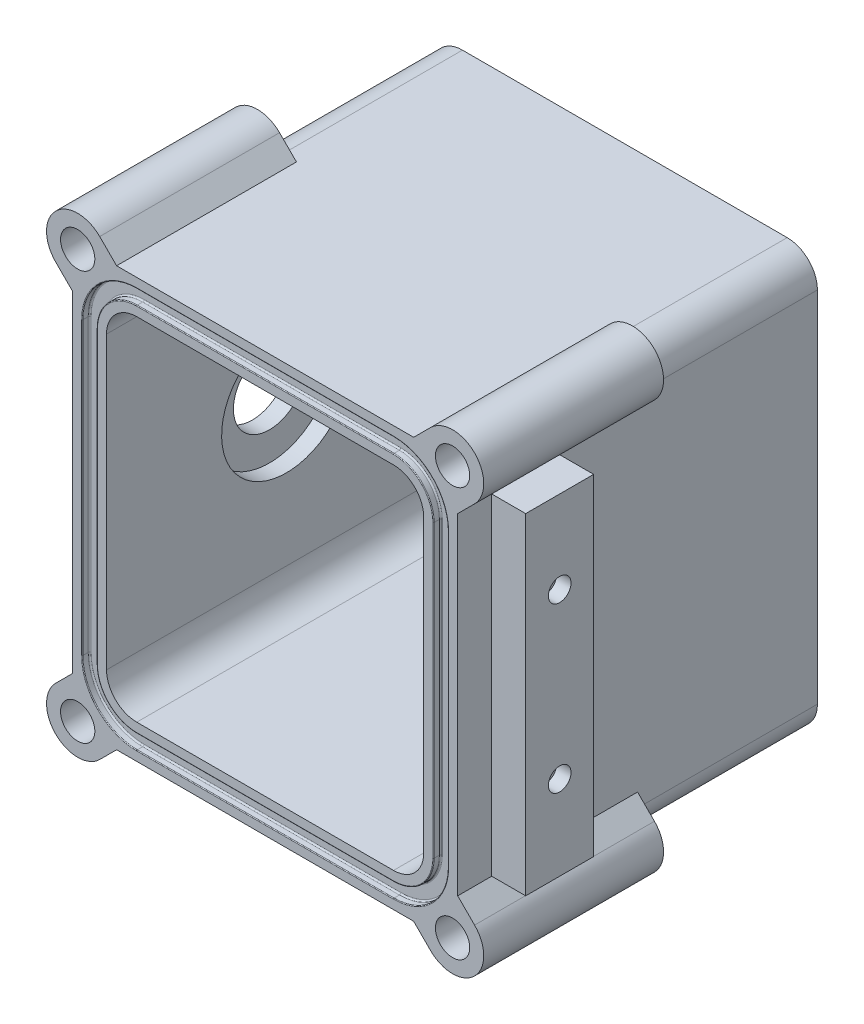
from build123d import *

# Parameters (mm, degrees)
BOSS_EXTRUDE1_DEPTH     = 31.75
SHELL1_T                = -6
FILLET1_R               = 5.334
CUT_EXTRUDE1_DEPTH      = 1.2954
FILLET2_R               = 0.254
FILLET3_R               = 0.127
BOSS_EXTRUDE2_DEPTH     = 31.75
SKETCH4_R               = 3.025
CUT_EXTRUDE2_DEPTH      = 9
MIRROR2_COPY_1_DEPTH    = 31.75
MIRROR2_COPY_2_SKETCH_R = 3.025
MIRROR2_COPY_2_DEPTH    = 9
SKETCH8_W               = 12
SKETCH8_H               = 58.443650814
BOSS_EXTRUDE3_DEPTH     = 6
SKETCH12_R              = 2
CUT_EXTRUDE6_DEPTH      = 2.54
SKETCH13_R              = 6.35
CUT_EXTRUDE10_DEPTH     = 6
SKETCH16_R              = 11.43
CUT_EXTRUDE14_DEPTH     = 3


with BuildPart() as part:
    # Sketch1 → Boss-Extrude1 (new, symmetric)
    with BuildSketch(Plane.XY):
        Polygon((-34, -37), (-34, -16.68), (-34, 16.68), (-34, 37), (34, 37), (34, -37), align=None)
    extrude(amount=BOSS_EXTRUDE1_DEPTH, both=True)

    # Shell1
    shell1_openings = [part.faces().sort_by_distance(p)[0] for p in [
        (0, 0, 31.75),
    ]]
    offset(amount=SHELL1_T, openings=shell1_openings, kind=Kind.INTERSECTION)

    # Fillet1
    fillet1_edges = [part.edges().sort_by_distance(p)[0] for p in [
        (34, 37, 0),
        (34, -37, 0),
        (-34, -37, 0),
        (-34, 37, 0),
        (28, 31, 3),
        (28, -31, 3),
        (-28, -31, 3),
        (-28, 31, 3),
    ]]
    fillet(fillet1_edges, radius=FILLET1_R)

    # Sketch2 → Cut-Extrude1 (cut)
    with BuildSketch(Plane.XY.offset(31.75)):
        with BuildLine():
            Line((32.2827, -25.666), (32.2827, 25.666))
            ThreePointArc((32.2827, 25.666), (29.466033783, 32.466033783), (22.666, 35.2827))
            Line((22.666, 35.2827), (-22.666, 35.2827))
            ThreePointArc((-22.666, 35.2827), (-29.466033783, 32.466033783), (-32.2827, 25.666))
            Line((-32.2827, 25.666), (-32.2827, -25.666))
            ThreePointArc((-32.2827, -25.666), (-29.466033783, -32.466033783), (-22.666, -35.2827))
            Line((-22.666, -35.2827), (22.666, -35.2827))
            ThreePointArc((22.666, -35.2827), (29.466033783, -32.466033783), (32.2827, -25.666))
        make_face()
        with BuildLine():
            Line((-29.7173, 25.666), (-29.7173, -25.666))
            ThreePointArc((-29.7173, -25.666), (-27.652022046, -30.652022046), (-22.666, -32.7173))
            Line((-22.666, -32.7173), (22.666, -32.7173))
            ThreePointArc((22.666, -32.7173), (27.652022046, -30.652022046), (29.7173, -25.666))
            Line((29.7173, -25.666), (29.7173, 25.666))
            ThreePointArc((29.7173, 25.666), (27.652022046, 30.652022046), (22.666, 32.7173))
            Line((22.666, 32.7173), (-22.666, 32.7173))
            ThreePointArc((-22.666, 32.7173), (-27.652022046, 30.652022046), (-29.7173, 25.666))
        make_face(mode=Mode.SUBTRACT)
    extrude(amount=-CUT_EXTRUDE1_DEPTH, mode=Mode.SUBTRACT)

    # Fillet2
    fillet2_edges = [part.edges().sort_by_distance(p)[0] for p in [
        (27.652022046, -30.652022046, 30.4546),
        (0, -32.7173, 30.4546),
        (-27.652022046, -30.652022046, 30.4546),
        (-29.7173, 0, 30.4546),
        (-27.652022046, 30.652022046, 30.4546),
        (0, 32.7173, 30.4546),
        (27.652022046, 30.652022046, 30.4546),
        (-29.466033783, 32.466033783, 30.4546),
        (0, 35.2827, 30.4546),
        (29.466033783, 32.466033783, 30.4546),
        (32.2827, 0, 30.4546),
        (29.466033783, -32.466033783, 30.4546),
        (0, -35.2827, 30.4546),
        (-29.466033783, -32.466033783, 30.4546),
        (29.7173, 0, 30.4546),
        (-32.2827, 0, 30.4546),
    ]]
    fillet(fillet2_edges, radius=FILLET2_R)

    # Fillet3
    fillet3_edges = [part.edges().sort_by_distance(p)[0] for p in [
        (-29.466033783, -32.466033783, 31.75),
        (-32.2827, 0, 31.75),
        (-29.466033783, 32.466033783, 31.75),
        (0, 35.2827, 31.75),
        (29.466033783, 32.466033783, 31.75),
        (32.2827, 0, 31.75),
        (29.466033783, -32.466033783, 31.75),
        (-27.652022046, -30.652022046, 31.75),
        (-29.7173, 0, 31.75),
        (-27.652022046, 30.652022046, 31.75),
        (0, 32.7173, 31.75),
        (27.652022046, 30.652022046, 31.75),
        (29.7173, 0, 31.75),
        (27.652022046, -30.652022046, 31.75),
        (0, -35.2827, 31.75),
        (0, -32.7173, 31.75),
    ]]
    fillet(fillet3_edges, radius=FILLET3_R)

    # Sketch3 → Boss-Extrude2 (add)
    with BuildSketch(Plane.XY.offset(31.75)):
        with BuildLine():
            ThreePointArc((30.741024965, -31.118858104), (29.555836344, -32.555836344), (28.118858104, -33.741024965))
            ThreePointArc((28.118858104, -33.741024965), (27.643498403, -35.335928432), (27.666944752, -37))
            Line((27.666944752, -37), (26.221825407, -37))
            Line((26.221825407, -37), (29.202282953, -39.980457546))
            ThreePointArc((29.202282953, -39.980457546), (36.980457546, -39.980457546), (36.980457546, -32.202282953))
            Line((36.980457546, -32.202282953), (34, -29.221825407))
            Line((34, -29.221825407), (34, -30.666944752))
            ThreePointArc((34, -30.666944752), (32.335928432, -30.643498403), (30.741024965, -31.118858104))
        make_face()
    boss_extrude2 = extrude(amount=-BOSS_EXTRUDE2_DEPTH)

    # Sketch4 → Cut-Extrude2 (cut)
    with BuildSketch(Plane.XY.offset(31.75)):
        with Locations((33.09137025, -36.09137025)):
            Circle(SKETCH4_R)
    cut_extrude2 = extrude(amount=-CUT_EXTRUDE2_DEPTH, mode=Mode.SUBTRACT)

    # Mirror1: Boss-Extrude2, Cut-Extrude2 across plane
    add(boss_extrude2.mirror(Plane.ZX))
    add(cut_extrude2.mirror(Plane.ZX), mode=Mode.SUBTRACT)

    # Mirror2: Boss-Extrude2, Cut-Extrude2 across plane
    add(boss_extrude2.mirror(Plane(origin=(0, 0, 0), x_dir=(0, 0, 1), z_dir=(1, 0, 0))))
    add(cut_extrude2.mirror(Plane(origin=(0, 0, 0), x_dir=(0, 0, 1), z_dir=(1, 0, 0))), mode=Mode.SUBTRACT)

    # Mirror2 copy 1 sketch → Mirror2 copy 1 (add)
    with BuildSketch(Plane(origin=(0, 0, 31.75), x_dir=(-1, 0, 0), z_dir=(0, 0, 1))):
        with BuildLine():
            ThreePointArc((30.741024965, -31.118858104), (29.555836344, -32.555836344), (28.118858104, -33.741024965))
            ThreePointArc((28.118858104, -33.741024965), (27.643498403, -35.335928432), (27.666944752, -37))
            Line((27.666944752, -37), (26.221825407, -37))
            Line((26.221825407, -37), (29.202282953, -39.980457546))
            ThreePointArc((29.202282953, -39.980457546), (36.980457546, -39.980457546), (36.980457546, -32.202282953))
            Line((36.980457546, -32.202282953), (34, -29.221825407))
            Line((34, -29.221825407), (34, -30.666944752))
            ThreePointArc((34, -30.666944752), (32.335928432, -30.643498403), (30.741024965, -31.118858104))
        make_face()
    extrude(amount=-MIRROR2_COPY_1_DEPTH)

    # Mirror2 copy 2 sketch → Mirror2 copy 2 (cut)
    with BuildSketch(Plane(origin=(0, 0, 31.75), x_dir=(-1, 0, 0), z_dir=(0, 0, 1))):
        with Locations((33.09137025, -36.09137025)):
            Circle(MIRROR2_COPY_2_SKETCH_R)
    extrude(amount=-MIRROR2_COPY_2_DEPTH, mode=Mode.SUBTRACT)

    # Sketch8 → Boss-Extrude3 (add)
    with BuildSketch(Plane.ZY.offset(34)):
        with Locations((19.75, 0)):
            Rectangle(SKETCH8_W, SKETCH8_H)
    boss_extrude3 = extrude(amount=BOSS_EXTRUDE3_DEPTH)

    # Sketch12 → Cut-Extrude6 (cut)
    with BuildSketch(Plane.ZY.offset(40)):
        with Locations((19.75, 14.616825407)):
            Circle(SKETCH12_R)
        with Locations((19.75, -14.339174593)):
            Circle(SKETCH12_R)
    cut_extrude6 = extrude(amount=-CUT_EXTRUDE6_DEPTH, mode=Mode.SUBTRACT)

    # Sketch13 → Cut-Extrude10 (cut)
    with BuildSketch(Plane.ZY.offset(34)):
        Circle(SKETCH13_R)
    extrude(amount=-CUT_EXTRUDE10_DEPTH, mode=Mode.SUBTRACT)

    # Sketch16 → Cut-Extrude14 (cut)
    with BuildSketch(Plane(origin=(-28, 0, 0), x_dir=(0, 0, -1), z_dir=(1, 0, 0))):
        Circle(SKETCH16_R)
    extrude(amount=-CUT_EXTRUDE14_DEPTH, mode=Mode.SUBTRACT)

    # Mirror5: Boss-Extrude3 across plane
    add(boss_extrude3.mirror(Plane(origin=(0, 0, 0), x_dir=(0, 0, 1), z_dir=(1, 0, 0))))

    # Mirror6: Cut-Extrude6 across plane
    add(cut_extrude6.mirror(Plane(origin=(0, 0, 0), x_dir=(0, 0, 1), z_dir=(1, 0, 0))), mode=Mode.SUBTRACT)


solid = part.part
